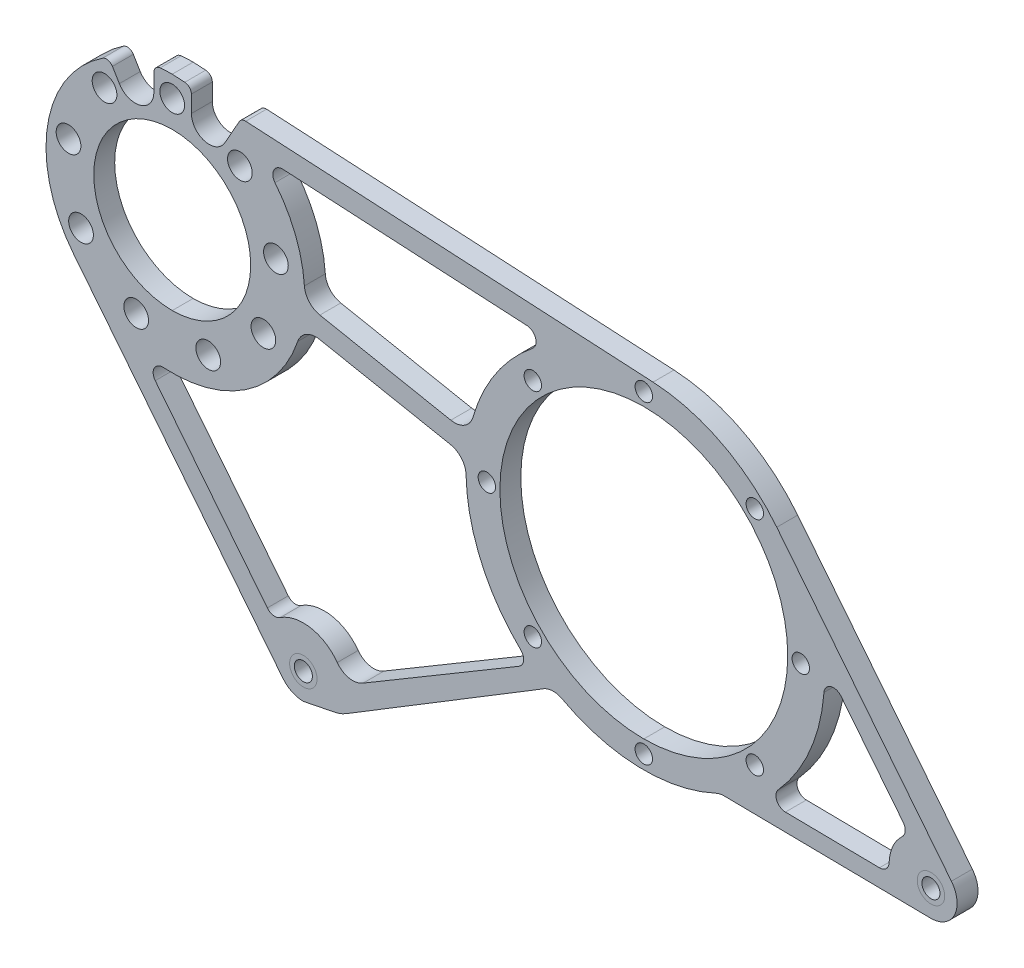
from build123d import *

# Parameters (mm, degrees)
SKETCH1_R               = 3.29946
SKETCH1_R_2             = 28.575
SKETCH1_R_3             = 52.4256
BOSS_EXTRUDE1_DEPTH     = 7.62
CUT_EXTRUDE1_DEPTH      = 314.319493614
CUT_EXTRUDE1_DEPTH_BACK = 314.319493614
SKETCH2_R               = 4.49961
SKETCH2_R_2             = 3.175
CUT_EXTRUDE2_DEPTH      = 314.319493614
CUT_EXTRUDE2_DEPTH_BACK = 314.319493614
FILLET2_R               = 12.7
CUT_EXTRUDE3_DEPTH      = 314.319493614
CUT_EXTRUDE3_DEPTH_BACK = 314.319493614
FILLET3_R               = 2.54


with BuildPart() as part:
    # Sketch1 → Boss-Extrude1 (new body)
    with BuildSketch(Plane.XY):
        with BuildLine():
            ThreePointArc((40.310707788, -124.394878894), (43.625834707, -127.040890072), (47.760987503, -127.985322704))
            Line((47.760987503, -127.985322704), (276.360987503, -82.143687357))
            ThreePointArc((276.360987503, -82.143687357), (284.941554871, -76.753840153), (283.811267218, -66.684131167))
            Line((283.811267218, -66.684131167), (220.199398147, 13.174615234))
            ThreePointArc((220.199398147, 13.174615234), (200.160512587, 29.620750083), (175.144631834, 36.420602736))
            Line((175.144631834, 36.420602736), (0, 45.974))
            ThreePointArc((0, 45.974), (-41.415538495, 19.959004162), (-35.960016757, -28.644124543))
            Line((-35.960016757, -28.644124543), (40.310707788, -124.394878894))
        make_face()
        with Locations((47.760987503, -118.460322704)):
            Circle(SKETCH1_R, mode=Mode.SUBTRACT)
        with Locations((276.360987503, -72.618687357)):
            Circle(SKETCH1_R, mode=Mode.SUBTRACT)
        Circle(SKETCH1_R_2, mode=Mode.SUBTRACT)
        with Locations((171.77258, -25.4)):
            Circle(SKETCH1_R_3, mode=Mode.SUBTRACT)
    extrude(amount=BOSS_EXTRUDE1_DEPTH)

    # Sketch2 → Cut-Extrude1 (cut, two sides: drawn at the far end of the back side and taken through both)
    with BuildSketch(Plane.XY.offset(7.62).offset(-CUT_EXTRUDE1_DEPTH_BACK)):
        with Locations((0, 38.354)):
            Circle(SKETCH2_R)
        with Locations((171.77258, 31.76905)):
            Circle(SKETCH2_R_2)
        with Locations((24.653475982, 29.380868571)):
            Circle(SKETCH2_R)
        with Locations((37.771316559, 6.660102206)):
            Circle(SKETCH2_R)
        with Locations((33.215538337, -19.177)):
            Circle(SKETCH2_R)
        with Locations((13.117840577, -36.040970778)):
            Circle(SKETCH2_R)
        with Locations((-13.117840577, -36.040970778)):
            Circle(SKETCH2_R)
        with Locations((-33.215538337, -19.177)):
            Circle(SKETCH2_R)
        with Locations((-37.771316559, 6.660102206)):
            Circle(SKETCH2_R)
        with Locations((-24.653475982, 29.380868571)):
            Circle(SKETCH2_R)
        with Locations((212.197202929, 15.024622929)):
            Circle(SKETCH2_R_2)
        with Locations((228.94163, -25.4)):
            Circle(SKETCH2_R_2)
        with Locations((212.197202929, -65.824622929)):
            Circle(SKETCH2_R_2)
        with Locations((171.77258, -82.56905)):
            Circle(SKETCH2_R_2)
        with Locations((131.347957071, -65.824622929)):
            Circle(SKETCH2_R_2)
        with Locations((114.60353, -25.4)):
            Circle(SKETCH2_R_2)
        with Locations((131.347957071, 15.024622929)):
            Circle(SKETCH2_R_2)
    extrude(amount=CUT_EXTRUDE1_DEPTH + CUT_EXTRUDE1_DEPTH_BACK, mode=Mode.SUBTRACT)

    # Sketch5 → Cut-Extrude2 (cut, two sides: drawn at the far end of the back side and taken through both)
    with BuildSketch(Plane(origin=(0, 0, 0), x_dir=(-1, 0, 0), z_dir=(0, 0, -1)).offset(-CUT_EXTRUDE2_DEPTH_BACK)):
        with BuildLine():
            Line((-243.589980451, -28.420218982), (-266.229006424, -56.84139667))
            ThreePointArc((-266.229006424, -56.84139667), (-266.978290112, -59.255128799), (-265.89655065, -61.539284785))
            ThreePointArc((-265.89655065, -61.539284785), (-262.4556706, -66.381719999), (-261.127541325, -72.171789682))
            ThreePointArc((-261.127541325, -72.171789682), (-260.057201806, -74.581862154), (-257.603993865, -75.549253906))
            Line((-257.603993865, -75.549253906), (-223.345463701, -75.103791216))
            ThreePointArc((-223.345463701, -75.103791216), (-220.204512197, -73.023273129), (-220.7984065, -69.302867047))
            ThreePointArc((-220.7984065, -69.302867047), (-232.320070073, -51.187493962), (-237.398113791, -30.327749345))
            ThreePointArc((-237.398113791, -30.327749345), (-239.843636661, -27.262743932), (-243.589980451, -28.420218982))
        make_face()
        with BuildLine():
            Line((-40.310932114, 36.143882278), (-129.2329494, 31.293563157))
            ThreePointArc((-129.2329494, 31.293563157), (-132.356283928, 28.883803437), (-131.222021432, 25.105495738))
            ThreePointArc((-131.222021432, 25.105495738), (-117.850437324, 10.482522615), (-109.525506814, -7.498749212))
            ThreePointArc((-109.525506814, -7.498749212), (-106.457644943, -11.526726906), (-101.474520552, -12.423862382))
            Line((-101.474520552, -12.423862382), (-53.780148142, -3.1149948))
            ThreePointArc((-53.780148142, -3.1149948), (-49.880239941, -0.880376651), (-48.149245066, 3.267690247))
            ThreePointArc((-48.149245066, 3.267690247), (-44.896236095, 17.701852573), (-37.423009556, 30.472052043))
            ThreePointArc((-37.423009556, 30.472052043), (-37.020434548, 34.248166986), (-40.310932114, 36.143882278))
        make_face()
        with BuildLine():
            ThreePointArc((-39.302161905, -105.783340827), (-36.833952554, -106.326913666), (-34.648894538, -105.056854494))
            Line((-34.648894538, -105.056854494), (6.186568412, -53.791753696))
            ThreePointArc((6.186568412, -53.791753696), (6.547130169, -50.008783233), (3.231709617, -48.151673418))
            ThreePointArc((3.231709617, -48.151673418), (-26.797926427, -40.13600303), (-45.712365207, -15.472791189))
            ThreePointArc((-45.712365207, -15.472791189), (-48.822624125, -11.670903611), (-53.666695197, -10.856633909))
            Line((-53.666695197, -10.856633909), (-101.374019125, -20.168029335))
            ThreePointArc((-101.374019125, -20.168029335), (-105.376863014, -22.522014289), (-107.019164045, -26.865613222))
            ThreePointArc((-107.019164045, -26.865613222), (-112.485034835, -51.479491719), (-126.935132299, -72.141375501))
            ThreePointArc((-126.935132299, -72.141375501), (-127.983236253, -75.050116103), (-126.302243919, -77.645026229))
            Line((-126.302243919, -77.645026229), (-69.528196733, -111.340573769))
            ThreePointArc((-69.528196733, -111.340573769), (-64.463868617, -112.307803939), (-60.115626386, -109.537290816))
            ThreePointArc((-60.115626386, -109.537290816), (-50.466052275, -103.462315351), (-39.302161905, -105.783340827))
        make_face()
        with BuildLine():
            Line((-276.360987503, -82.143687357), (-61.405360183, -125.24918816))
            Line((-61.405360183, -125.24918816), (-134.620271919, -80.665110684))
            ThreePointArc((-134.620271919, -80.665110684), (-138.295422572, -79.292203946), (-142.130961394, -80.116974938))
            ThreePointArc((-142.130961394, -80.116974938), (-169.881448075, -87.601258187), (-198.035354318, -81.816660528))
            ThreePointArc((-198.035354318, -81.816660528), (-199.517976868, -81.319553012), (-201.07403482, -81.164733259))
            Line((-201.07403482, -81.164733259), (-276.360987503, -82.143687357))
        make_face()
    extrude(amount=CUT_EXTRUDE2_DEPTH + CUT_EXTRUDE2_DEPTH_BACK, mode=Mode.SUBTRACT)

    # Fillet2
    fillet2_edges = [part.edges().sort_by_distance(p)[0] for p in [
        (61.405360183, -125.24918816, 3.81),
    ]]
    fillet(fillet2_edges, radius=FILLET2_R)

    # Sketch6 → Cut-Extrude3 (cut, two sides: drawn at the far end of the back side and taken through both)
    with BuildSketch(Plane(origin=(0, 0, 0), x_dir=(-1, 0, 0), z_dir=(0, 0, -1)).offset(-CUT_EXTRUDE3_DEPTH_BACK)):
        with BuildLine():
            Line((-19.149599026, 33.871202127), (-25.180470346, 44.600512078))
            Line((-25.180470346, 44.600512078), (-6.983635222, 45.593072301))
            Line((-6.983635222, 45.593072301), (-6.983635222, 37.0560801))
            ThreePointArc((-6.983635222, 37.0560801), (-11.837393988, 30.76811296), (-19.149599026, 33.871202127))
        make_face()
        with BuildLine():
            Line((6.694264778, 36.870190043), (6.694264778, 45.484013621))
            ThreePointArc((6.694264778, 45.484013621), (15.174774423, 43.397406572), (23.107677895, 39.744734221))
            Line((23.107677895, 39.744734221), (19.260113276, 33.371320679))
            ThreePointArc((19.260113276, 33.371320679), (11.648320448, 30.348253304), (6.694264778, 36.870190043))
        make_face()
    extrude(amount=CUT_EXTRUDE3_DEPTH + CUT_EXTRUDE3_DEPTH_BACK, mode=Mode.SUBTRACT)

    # Fillet3
    fillet3_edges = [part.edges().sort_by_distance(p)[0] for p in [
        (-6.694264778, 45.484013621, 3.81),
        (6.983635222, 45.593072301, 3.81),
        (-23.107677895, 39.744734221, 3.81),
        (25.180470346, 44.600512078, 3.81),
    ]]
    fillet(fillet3_edges, radius=FILLET3_R)


solid = part.part
